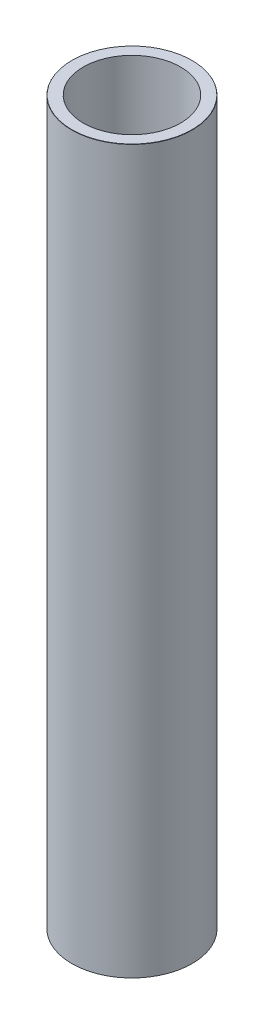
from build123d import *
from OCP.BRepFilletAPI import BRepFilletAPI_MakeChamfer

# Parameters (mm, degrees)
SKETCH1_R           = 50
BOSS_EXTRUDE1_DEPTH = 600
SKETCH2_R           = 40.413772936
CUT_EXTRUDE1_DEPTH  = 605.15229868
CHAMFER1_SIZE       = 0.201069175
CHAMFER1_SIZE2      = 0.116087342


with BuildPart() as part:
    # Sketch1 → Boss-Extrude1 (new body)
    with BuildSketch(Plane(origin=(0, 0, 0), x_dir=(1, 0, 0), z_dir=(0, 1, 0))):
        Circle(SKETCH1_R)
    extrude(amount=BOSS_EXTRUDE1_DEPTH)

    # Sketch2 → Cut-Extrude1 (cut, through all)
    with BuildSketch(Plane(origin=(0, 0, 0), x_dir=(1, 0, 0), z_dir=(0, 1, 0))):
        Circle(SKETCH2_R)
    extrude(amount=CUT_EXTRUDE1_DEPTH, mode=Mode.SUBTRACT)

    # Chamfer1: one chamfer whose edges measure the first distance from different faces: ONE call of the kernel's chamfer builder (chamfer() names one face for all edges)
    chamfer1_edges_1 = [part.edges().sort_by_distance(p)[0] for p in [
        (-50, 600, 0),
    ]]
    chamfer1_side_1 = [part.faces().sort_by_distance(p)[0] for p in [
        (-50, 300, 0),
    ]]
    chamfer1_edges_2 = [part.edges().sort_by_distance(p)[0] for p in [
        (-50, 0, 0),
    ]]
    chamfer1_side_2 = [part.faces().sort_by_distance(p)[0] for p in [
        (-48.585786438, 0, 0),
    ]]
    chamfer1 = BRepFilletAPI_MakeChamfer(part.part.solid().wrapped)
    for e in chamfer1_edges_1:
        chamfer1.Add(CHAMFER1_SIZE, CHAMFER1_SIZE2, e.wrapped, chamfer1_side_1[0].wrapped)  # the first distance lies on this face
    for e in chamfer1_edges_2:
        chamfer1.Add(CHAMFER1_SIZE, CHAMFER1_SIZE2, e.wrapped, chamfer1_side_2[0].wrapped)  # the first distance lies on this face
    add(Compound.cast(chamfer1.Shape()), mode=Mode.REPLACE)


solid = part.part
